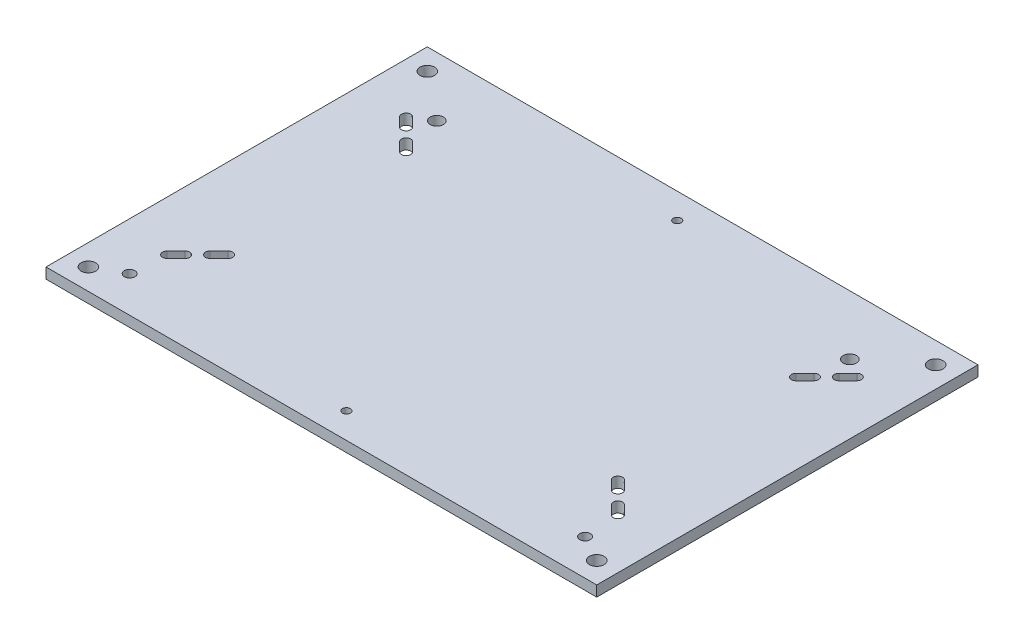
from build123d import *

# Parameters (mm, degrees)
SKETCH1_W                      = 330.2
SKETCH1_H                      = 228.6
BASE_PLATE_DEPTH               = 6.35
SLOTS_DEPTH                    = 402.659460862
FEET_CONNECTION_HOLE_D         = 8.7376
F_1_4_0_25_DIAMETER_HOLE1_D    = 6.35
F_5_16_0_3125_DIAMETER_HOLE1_D = 7.9375
ESD_CONNECTION_HOLE_D          = 4.7625


with BuildPart() as part:
    # Sketch1 → base plate (new body)
    with BuildSketch(Plane(origin=(0, 0, 0), x_dir=(1, 0, 0), z_dir=(0, 1, 0))):
        with Locations((165.1, -114.3)):
            Rectangle(SKETCH1_W, SKETCH1_H)
    extrude(amount=-BASE_PLATE_DEPTH)

    # Sketch3 → slots (cut, through all)
    with BuildSketch(Plane(origin=(0, 0, 0), x_dir=(1, 0, 0), z_dir=(0, 1, 0))):
        with BuildLine():
            Line((33.404828058, -178.606084521), (28.016674385, -183.994238194))
            ThreePointArc((28.016674385, -183.994238194), (28.016674385, -187.883325615), (31.905761806, -187.883325615))
            Line((31.905761806, -187.883325615), (37.293915479, -182.495171942))
            ThreePointArc((37.293915479, -182.495171942), (37.293915479, -178.606084521), (33.404828058, -178.606084521))
        make_face()
        with BuildLine():
            Line((44.775105348, -175.013982073), (50.163259021, -169.6258284))
            ThreePointArc((50.163259021, -169.6258284), (50.163259021, -165.736740979), (46.2741716, -165.736740979))
            Line((46.2741716, -165.736740979), (40.886017927, -171.124894652))
            ThreePointArc((40.886017927, -171.124894652), (40.886017927, -175.013982073), (44.775105348, -175.013982073))
        make_face()
        with BuildLine():
            ThreePointArc((31.905761806, -40.716674385), (28.016674385, -40.716674385), (28.016674385, -44.605761806))
            Line((28.016674385, -44.605761806), (33.404828058, -49.993915479))
            ThreePointArc((33.404828058, -49.993915479), (37.293915479, -49.993915479), (37.293915479, -46.104828058))
            Line((37.293915479, -46.104828058), (31.905761806, -40.716674385))
        make_face()
        with BuildLine():
            ThreePointArc((46.2741716, -62.863259021), (50.163259021, -62.863259021), (50.163259021, -58.9741716))
            Line((50.163259021, -58.9741716), (44.775105348, -53.586017927))
            ThreePointArc((44.775105348, -53.586017927), (40.886017927, -53.586017927), (40.886017927, -57.475105348))
            Line((40.886017927, -57.475105348), (46.2741716, -62.863259021))
        make_face()
        with BuildLine():
            Line((296.795171942, -49.993915479), (302.183325615, -44.605761806))
            ThreePointArc((302.183325615, -44.605761806), (302.183325615, -40.716674385), (298.294238194, -40.716674385))
            Line((298.294238194, -40.716674385), (292.906084521, -46.104828058))
            ThreePointArc((292.906084521, -46.104828058), (292.906084521, -49.993915479), (296.795171942, -49.993915479))
        make_face()
        with BuildLine():
            Line((285.424894652, -53.586017927), (280.036740979, -58.9741716))
            ThreePointArc((280.036740979, -58.9741716), (280.036740979, -62.863259021), (283.9258284, -62.863259021))
            Line((283.9258284, -62.863259021), (289.313982073, -57.475105348))
            ThreePointArc((289.313982073, -57.475105348), (289.313982073, -53.586017927), (285.424894652, -53.586017927))
        make_face()
        with BuildLine():
            ThreePointArc((283.9258284, -165.736740979), (280.036740979, -165.736740979), (280.036740979, -169.6258284))
            Line((280.036740979, -169.6258284), (285.424894652, -175.013982073))
            ThreePointArc((285.424894652, -175.013982073), (289.313982073, -175.013982073), (289.313982073, -171.124894652))
            Line((289.313982073, -171.124894652), (283.9258284, -165.736740979))
        make_face()
        with BuildLine():
            ThreePointArc((298.294238194, -187.883325615), (302.183325615, -187.883325615), (302.183325615, -183.994238194))
            Line((302.183325615, -183.994238194), (296.795171942, -178.606084521))
            ThreePointArc((296.795171942, -178.606084521), (292.906084521, -178.606084521), (292.906084521, -182.495171942))
            Line((292.906084521, -182.495171942), (298.294238194, -187.883325615))
        make_face()
    extrude(amount=-SLOTS_DEPTH, mode=Mode.SUBTRACT)

    # Feet connection hole (through all)
    with Locations(Plane(origin=(0, 0, 0), x_dir=(1, 0, 0), z_dir=(0, 1, 0))):
        with Locations((12.7, -215.9), (317.5, -12.7), (317.5, -215.9), (12.7, -12.7)):
            Hole(FEET_CONNECTION_HOLE_D / 2)

    # 1/4 (0.25) Diameter Hole1 (through all)
    with Locations(Plane(origin=(0, 0, 0), x_dir=(1, 0, 0), z_dir=(0, 1, 0))):
        with Locations((28.575, -207.01), (301.625, -207.01)):
            Hole(F_1_4_0_25_DIAMETER_HOLE1_D / 2)

    # 5/16 (0.3125) Diameter Hole1 (through all)
    with Locations(Plane(origin=(0, 0, 0), x_dir=(1, 0, 0), z_dir=(0, 1, 0))):
        with Locations((41.275, -35.56), (288.925, -35.56)):
            Hole(F_5_16_0_3125_DIAMETER_HOLE1_D / 2)

    # ESD Connection hole (through all)
    with Locations(Plane(origin=(0, 0, 0), x_dir=(1, 0, 0), z_dir=(0, 1, 0))):
        with Locations((165.1, -15.24), (164.768662044, -213.266978445)):
            Hole(ESD_CONNECTION_HOLE_D / 2)


solid = part.part
